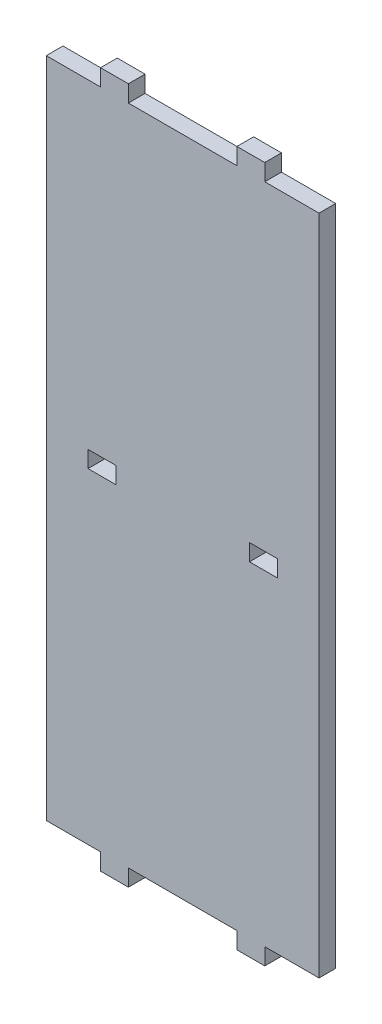
from build123d import *

# Parameters (mm, degrees)
ESQUISSE1_W        = 98
ESQUISSE1_H        = 238
ESQUISSE1_W_2      = 10
ESQUISSE1_H_2      = 6
BOSS_EXTRU_1_DEPTH = 6
ESQUISSE2_W        = 10
ESQUISSE2_H        = 6
BOSS_EXTRU_2_DEPTH = 6


with BuildPart() as part:
    # Esquisse1 → Boss.-Extru.1 (new body)
    with BuildSketch(Plane.XY):
        Rectangle(ESQUISSE1_W, ESQUISSE1_H)
        with Locations((29, 1)):
            Rectangle(ESQUISSE1_W_2, ESQUISSE1_H_2, mode=Mode.SUBTRACT)
        with Locations((-29, 1)):
            Rectangle(ESQUISSE1_W_2, ESQUISSE1_H_2, mode=Mode.SUBTRACT)
    extrude(amount=BOSS_EXTRU_1_DEPTH)

    # Esquisse2 → Boss.-Extru.2 (add)
    with BuildSketch(Plane.XY.offset(6)):
        with Locations((24.5, -122)):
            Rectangle(ESQUISSE2_W, ESQUISSE2_H)
        with Locations((-24.5, -122)):
            Rectangle(ESQUISSE2_W, ESQUISSE2_H)
        with Locations((-24.5, 122)):
            Rectangle(ESQUISSE2_W, ESQUISSE2_H)
        with Locations((24.5, 122)):
            Rectangle(ESQUISSE2_W, ESQUISSE2_H)
    extrude(amount=-BOSS_EXTRU_2_DEPTH)


solid = part.part
